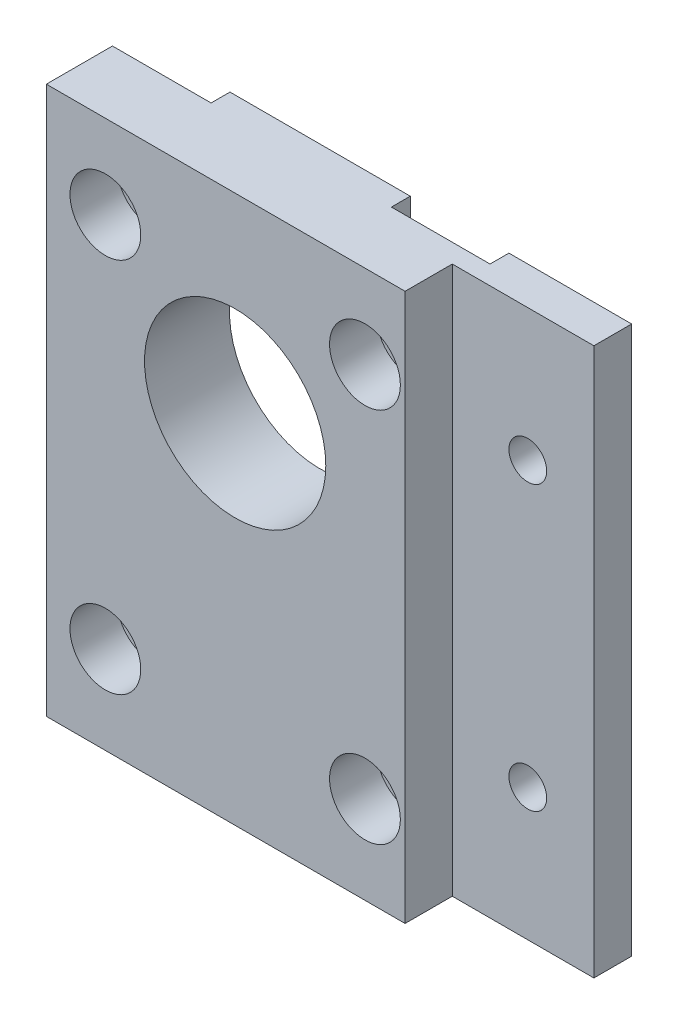
from build123d import *

# Parameters (mm, degrees)
SKETCH1_R           = 4.2
SKETCH1_R_2         = 9.6
BOSS_EXTRUDE1_DEPTH = 2
SKETCH4_W           = 53
SKETCH4_H           = 58
SKETCH4_R           = 2
SKETCH4_R_2         = 9.6
BOSS_EXTRUDE3_DEPTH = 2
SKETCH5_R           = 2
CUT_EXTRUDE1_DEPTH  = 4
SKETCH6_W           = 38
SKETCH6_H           = 58
SKETCH6_R           = 3.75
SKETCH6_R_2         = 9.6
BOSS_EXTRUDE4_DEPTH = 5


with BuildPart() as part:
    # Sketch1 → Boss-Extrude1 (new body)
    with BuildSketch(Plane.XY):
        with BuildLine():
            Line((33, 29), (20, 29))
            Line((20, 29), (20, 21.814655719))
            Line((20, 21.814655719), (17.207493701, 17.765521586))
            ThreePointArc((17.207493701, 17.765521586), (12.50129538, 16.139920603), (9.55, 20.15))
            Line((9.55, 20.15), (9.55, 29))
            Line((9.55, 29), (-9.55, 29))
            Line((-9.55, 29), (-9.55, 20.15))
            ThreePointArc((-9.55, 20.15), (-12.50129538, 16.139920603), (-17.207493701, 17.765521586))
            Line((-17.207493701, 17.765521586), (-20, 21.814655719))
            Line((-20, 21.814655719), (-20, -16.278610808))
            Line((-20, -16.278610808), (-16.186, -16.278610808))
            Line((-16.186, -16.278610808), (-12.112917629, -13.378610808))
            ThreePointArc((-12.112917629, -13.378610808), (-6.255528438, -14.364), (-7.240917629, -20.221389192))
            Line((-7.240917629, -20.221389192), (-11.314, -23.121389192))
            Line((-11.314, -23.121389192), (-11.314, -29))
            Line((-11.314, -29), (9.55, -29))
            Line((9.55, -29), (9.55, -19.7))
            ThreePointArc((9.55, -19.7), (12.50129538, -15.689920603), (17.207493701, -17.315521586))
            Line((17.207493701, -17.315521586), (20, -21.364655719))
            Line((20, -21.364655719), (20, -29))
            Line((20, -29), (33, -29))
            Line((33, -29), (33, 29))
        make_face()
        with Locations((-5.725, -6.1)):
            Circle(SKETCH1_R, mode=Mode.SUBTRACT)
        with Locations((5.725, -6.1)):
            Circle(SKETCH1_R, mode=Mode.SUBTRACT)
        with Locations((0, 8.8)):
            Circle(SKETCH1_R_2, mode=Mode.SUBTRACT)
    extrude(amount=BOSS_EXTRUDE1_DEPTH)

    # Sketch4 → Boss-Extrude3 (add)
    with BuildSketch(Plane.XY.offset(2)):
        with Locations((6.5, 0)):
            Rectangle(SKETCH4_W, SKETCH4_H)
        with Locations((13.75, -19.7)):
            Circle(SKETCH4_R, mode=Mode.SUBTRACT)
        with Locations((-13.75, 20.15)):
            Circle(SKETCH4_R, mode=Mode.SUBTRACT)
        with Locations((13.75, 20.15)):
            Circle(SKETCH4_R, mode=Mode.SUBTRACT)
        with Locations((-13.75, -19.7)):
            Circle(SKETCH4_R, mode=Mode.SUBTRACT)
        with Locations((0, 8.8)):
            Circle(SKETCH4_R_2, mode=Mode.SUBTRACT)
    extrude(amount=BOSS_EXTRUDE3_DEPTH)

    # Sketch5 → Cut-Extrude1 (cut)
    with BuildSketch(Plane.XY.offset(4)):
        with Locations((26, 15)):
            Circle(SKETCH5_R)
        with Locations((26, -15)):
            Circle(SKETCH5_R)
    extrude(amount=-CUT_EXTRUDE1_DEPTH, mode=Mode.SUBTRACT)

    # Sketch6 → Boss-Extrude4 (add)
    with BuildSketch(Plane.XY.offset(4)):
        with Locations((-1, 0)):
            Rectangle(SKETCH6_W, SKETCH6_H)
        with Locations((-13.75, -19.7)):
            Circle(SKETCH6_R, mode=Mode.SUBTRACT)
        with Locations((13.75, -19.7)):
            Circle(SKETCH6_R, mode=Mode.SUBTRACT)
        with Locations((0, 8.8)):
            Circle(SKETCH6_R_2, mode=Mode.SUBTRACT)
        with Locations((-13.75, 20.15)):
            Circle(SKETCH6_R, mode=Mode.SUBTRACT)
        with Locations((13.75, 20.15)):
            Circle(SKETCH6_R, mode=Mode.SUBTRACT)
    extrude(amount=BOSS_EXTRUDE4_DEPTH)


solid = part.part
